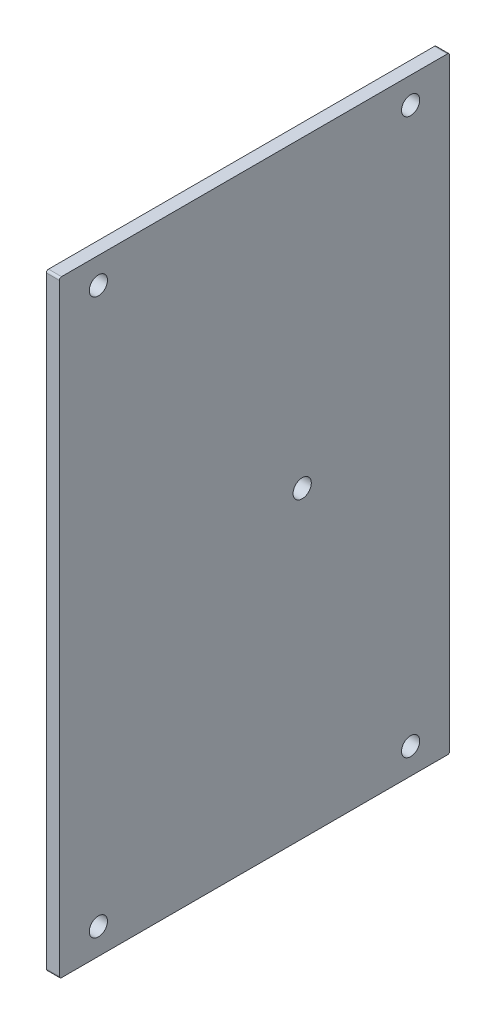
from build123d import *

# Parameters (mm, degrees)
SKETCH1_W           = 90
SKETCH1_H           = 140
SKETCH1_R           = 2.1
BOSS_EXTRUDE1_DEPTH = 3
FILLET1_R           = 0.5


with BuildPart() as part:
    # Sketch1 → Boss-Extrude1 (new body)
    with BuildSketch(Plane(origin=(0, 0, 0), x_dir=(0, 0, -1), z_dir=(1, 0, 0))):
        with Locations((45, -70)):
            Rectangle(SKETCH1_W, SKETCH1_H)
        with Locations((56, -70)):
            Circle(SKETCH1_R, mode=Mode.SUBTRACT)
        with Locations((9, -6)):
            Circle(SKETCH1_R, mode=Mode.SUBTRACT)
        with Locations((81, -6)):
            Circle(SKETCH1_R, mode=Mode.SUBTRACT)
        with Locations((81, -134)):
            Circle(SKETCH1_R, mode=Mode.SUBTRACT)
        with Locations((9, -134)):
            Circle(SKETCH1_R, mode=Mode.SUBTRACT)
    extrude(amount=BOSS_EXTRUDE1_DEPTH)

    # Fillet1
    fillet1_edges = [part.edges().sort_by_distance(p)[0] for p in [
        (1.5, -140, -90),
        (1.5, -140, 0),
        (1.5, 0, -90),
        (1.5, 0, 0),
    ]]
    fillet(fillet1_edges, radius=FILLET1_R)


solid = part.part
